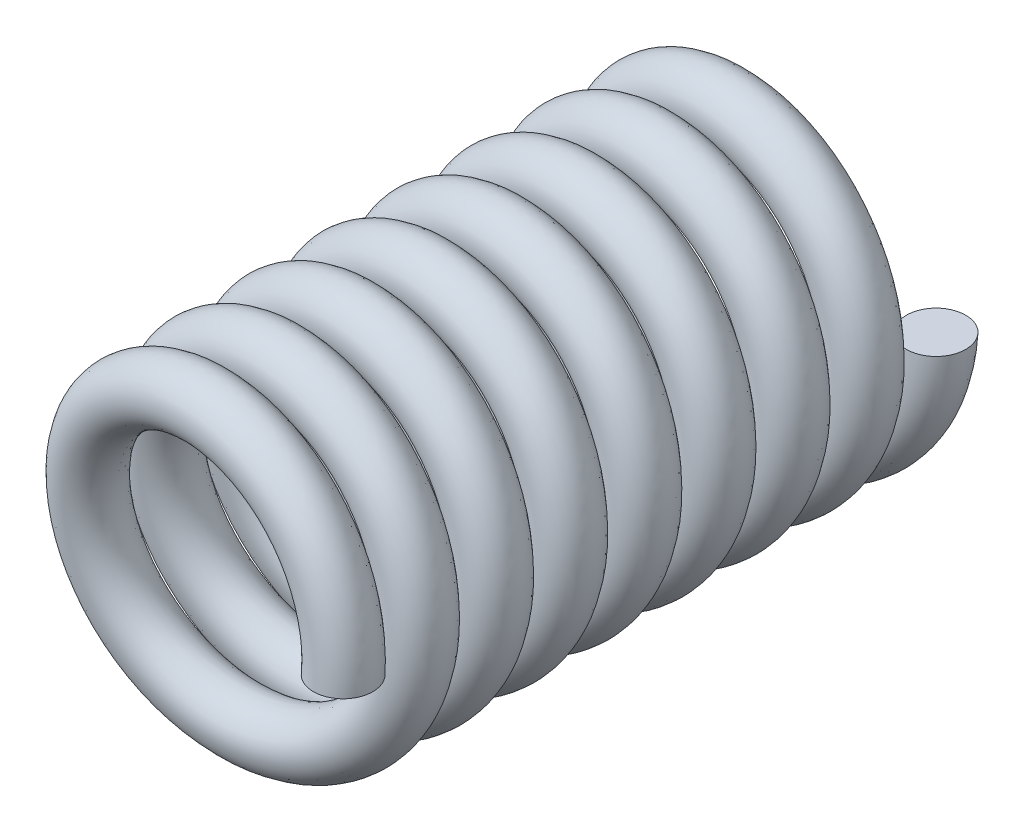
from build123d import *

# Parameters (mm, degrees)
SWEEP1_PITCH = 12.7


with BuildPart() as part:
    # Sweep1: arcs per turn and ends read off the stored shape
    # Sweep1: the profile of Sketch2 screwed along a left-hand helix through 8 turns, 18 arcs to a turn; built about Z, then put on its axis
    sweep1_z = Axis((0, 0, 0), (0, 0, 1))
    sweep1_corners = [(29.636919669, -5.225788563, 0), (24.634096284, -4.34365582, -5.08), (19.631272899, -3.461523078, 0), (24.634096284, -4.34365582, 5.08)]
    with BuildLine(mode=Mode.PRIVATE) as sweep1_profile:
        ThreePointArc((29.636919669, -5.225788563, 0), (28.171626625, -4.967417864, -3.592102448), (24.634096284, -4.34365582, -5.08))
        ThreePointArc((24.634096284, -4.34365582, -5.08), (21.096565943, -3.719893776, -3.592102448), (19.631272899, -3.461523078, 0))
        ThreePointArc((19.631272899, -3.461523078, 0), (21.096565943, -3.719893776, 3.592102448), (24.634096284, -4.34365582, 5.08))
        ThreePointArc((24.634096284, -4.34365582, 5.08), (28.171626625, -4.967417864, 3.592102448), (29.636919669, -5.225788563, 0))
    sweep1_cap = Face(sweep1_profile.wire())
    sweep1_arcs = [((29.636919669, -5.225788563, 0), (29.636919669, -5.225788563, -5.08), (24.634096284, -4.34365582, -5.08), (1, 0.7071067811865476, 1)), ((24.634096284, -4.34365582, -5.08), (19.631272899, -3.461523078, -5.08), (19.631272899, -3.461523078, 0), (1, 0.7071067811865476, 1)), ((19.631272899, -3.461523078, 0), (19.631272899, -3.461523078, 5.08), (24.634096284, -4.34365582, 5.08), (1, 0.7071067811865476, 1)), ((24.634096284, -4.34365582, 5.08), (29.636919669, -5.225788563, 5.08), (29.636919669, -5.225788563, 0), (1, 0.7071067811865476, 1))]  # start, shoulder, end, weights
    sweep1_turn_angles = [0, -10, -20, -30, -40, -50, -60, -70, -80, -90, -100, -110, -120, -130, -140, -150, -160, -170, -180, -190, -200, -210, -220, -230, -240, -250, -260, -270, -280, -290, -300, -310, -320, -330, -340, -350, -360]
    sweep1_turn_weights = [1, 0.984807753012208, 1, 0.984807753012208, 1, 0.984807753012208, 1, 0.984807753012208, 1, 0.984807753012208, 1, 0.984807753012208, 1, 0.984807753012208, 1, 0.984807753012208, 1, 0.984807753012208, 1, 0.984807753012208, 1, 0.984807753012208, 1, 0.984807753012208, 1, 0.984807753012208, 1, 0.984807753012208, 1, 0.984807753012208, 1, 0.984807753012208, 1, 0.984807753012208, 1, 0.984807753012208, 1]
    sweep1_turn_sides = [Face.make_bezier_surface([[Vector(p[j][0], p[j][1], 0).rotate(sweep1_z, sweep1_turn_angles[2 * i + k]) / sweep1_turn_weights[2 * i + k] + Vector(0, 0, p[j][2] + -SWEEP1_PITCH * sweep1_turn_angles[2 * i + k] / 360) for k in range(3)] for j in range(3)], [[p[3][j] * sweep1_turn_weights[2 * i + k] for k in range(3)] for j in range(3)]) for p in sweep1_arcs for i in range(18)]
    sweep1 = Plane(origin=(0, 0, 0), x_dir=(0.984807753012208, 0.17364817766693072, 0), z_dir=(0, 0, 1)) * Solid(Shell([*[p.moved(Location((0, 0, SWEEP1_PITCH * i))) for i in range(8) for p in sweep1_turn_sides], sweep1_cap, sweep1_cap.rotate(sweep1_z, -2880).moved(Location((0, 0, -SWEEP1_PITCH * -2880 / 360)))]))
    add(sweep1)


solid = part.part
